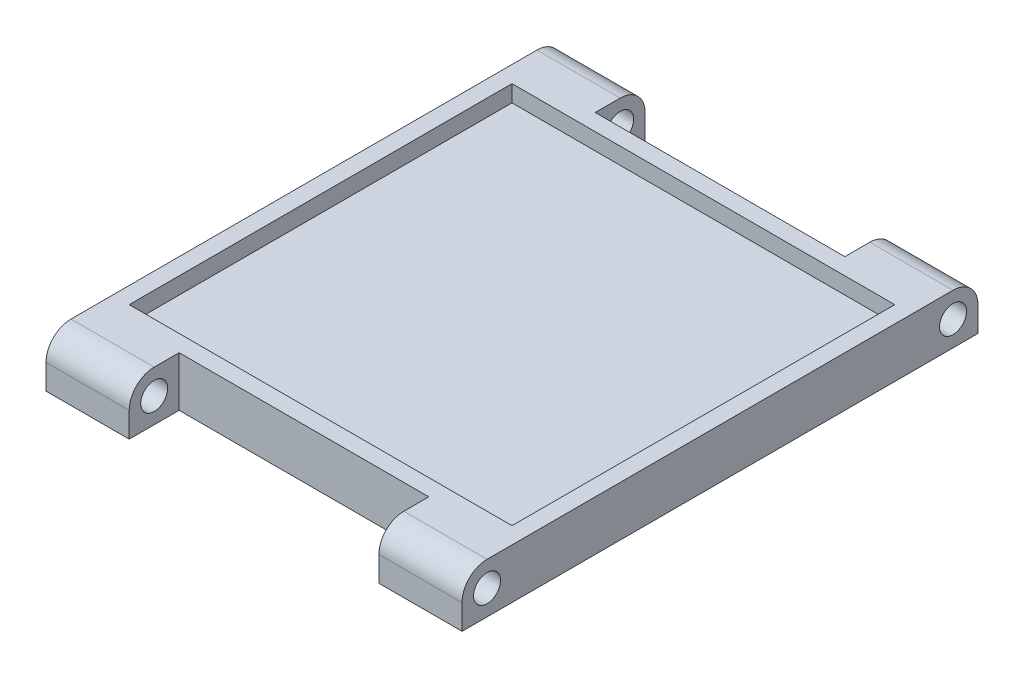
from build123d import *

# Parameters (mm, degrees)
SKETCH1_W            = 125
SKETCH1_H            = 125
BOSS_EXTRUDE1_DEPTH  = 15
SKETCH2_W            = 115
SKETCH2_H            = 115
CUT_EXTRUDE1_DEPTH   = 5
SKETCH3_W            = 15
SKETCH3_H            = 15
BOSS_EXTRUDE12_DEPTH = 25
SKETCH4_R            = 4.05
CUT_EXTRUDE2_DEPTH   = 25
FILLET1_R            = 7.5
FILLET1_OF_MIRROR1_R = 7.5
MIRROR2_START        = -62.5
MIRROR2_OUTLINE_R    = 4.05
MIRROR2_DEPTH        = 25
MIRROR2_START_2      = 37.5
MIRROR2_2_OUTLINE_R  = 4.05
MIRROR2_2_DEPTH      = 25


# Read off the part's stored shape, not the designer's step: Mirror2
with BuildPart() as part:
    # Sketch1 → Boss-Extrude1 (new body)
    with BuildSketch(Plane(origin=(0, 0, 0), x_dir=(1, 0, 0), z_dir=(0, 1, 0))):
        Rectangle(SKETCH1_W, SKETCH1_H)
    extrude(amount=BOSS_EXTRUDE1_DEPTH)

    # Sketch2 → Cut-Extrude1 (cut)
    with BuildSketch(Plane(origin=(0, 15, 0), x_dir=(1, 0, 0), z_dir=(0, 1, 0))):
        Rectangle(SKETCH2_W, SKETCH2_H)
    extrude(amount=-CUT_EXTRUDE1_DEPTH, mode=Mode.SUBTRACT)

    # Sketch3 → Boss-Extrude12 (add)
    with BuildSketch(Plane.ZY.offset(62.5)):
        with Locations((-70, 7.5)):
            Rectangle(SKETCH3_W, SKETCH3_H)
    boss_extrude12 = extrude(amount=-BOSS_EXTRUDE12_DEPTH)

    # Sketch4 → Cut-Extrude2 (cut)
    with BuildSketch(Plane.ZY.offset(62.5)):
        with Locations((-70, 7.5)):
            Circle(SKETCH4_R)
    cut_extrude2 = extrude(amount=-CUT_EXTRUDE2_DEPTH, mode=Mode.SUBTRACT)

    # Fillet1
    fillet1_edges = [part.edges().sort_by_distance(p)[0] for p in [
        (-50, 15, -77.5),
    ]]
    fillet(fillet1_edges, radius=FILLET1_R)

    # Mirror1: Boss-Extrude12, Cut-Extrude2 across plane
    add(boss_extrude12.mirror(Plane(origin=(0, 0, 0), x_dir=(0, 0, 1), z_dir=(1, 0, 0))))
    add(cut_extrude2.mirror(Plane(origin=(0, 0, 0), x_dir=(0, 0, 1), z_dir=(1, 0, 0))), mode=Mode.SUBTRACT)

    # Fillet1 of Mirror1
    fillet1_of_mirror1_edges = [part.edges().sort_by_distance(p)[0] for p in [
        (50, 15, -77.5),
    ]]
    fillet(fillet1_of_mirror1_edges, radius=FILLET1_OF_MIRROR1_R)

    # Mirror2 outline → Mirror2 (add)
    with BuildSketch(Plane.YZ.offset(MIRROR2_START)):
        with BuildLine():
            Line((15, 62.5), (15, 70))
            ThreePointArc((15, 70), (12.803300859, 75.303300859), (7.5, 77.5))
            Line((7.5, 77.5), (0, 77.5))
            Line((0, 77.5), (0, 62.5))
            Line((0, 62.5), (15, 62.5))
        make_face()
        with Locations((7.5, 70)):
            Circle(MIRROR2_OUTLINE_R, mode=Mode.SUBTRACT)
    extrude(amount=MIRROR2_DEPTH)

    # Mirror2 2 outline → Mirror2 2 (add)
    with BuildSketch(Plane.YZ.offset(MIRROR2_START_2)):
        with BuildLine():
            Line((15, 62.5), (15, 70))
            ThreePointArc((15, 70), (12.803300859, 75.303300859), (7.5, 77.5))
            Line((7.5, 77.5), (0, 77.5))
            Line((0, 77.5), (0, 62.5))
            Line((0, 62.5), (15, 62.5))
        make_face()
        with Locations((7.5, 70)):
            Circle(MIRROR2_2_OUTLINE_R, mode=Mode.SUBTRACT)
    extrude(amount=MIRROR2_2_DEPTH)


solid = part.part
